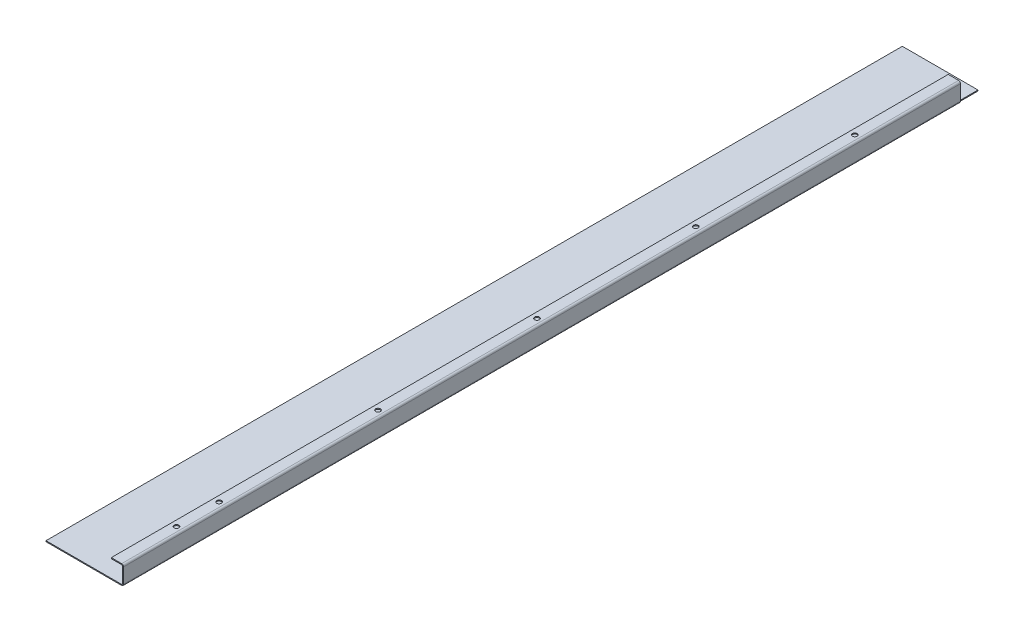
from build123d import *

# Parameters (mm, degrees)
SKETCH1_W                    = 82
SKETCH1_H                    = 905.2
BASE_FLANGE1_DEPTH           = 1
EDGE_FLANGE1_STRIP_W         = 6
EDGE_FLANGE1_STRIP_H         = 1
EDGE_FLANGE1_STRIP_CUT_DEPTH = 905.2
EDGE_FLANGE1_DEPTH           = 905.2
EDGE_FLANGE2_STRIP_W         = 6
EDGE_FLANGE2_STRIP_H         = 1
EDGE_FLANGE2_STRIP_CUT_DEPTH = 905.2
EDGE_FLANGE2_DEPTH           = 905.2
SKETCH19_R                   = 2.5
CUT_EXTRUDE2_DEPTH           = 10
CUT_EXTRUDE3_START           = -905.2
CUT_EXTRUDE3_DEPTH           = 20.5


# Read off the part's stored shape, not the designer's step: Cut-Extrude3
# Sheet-metal steps are written as plain solids
with BuildPart() as part:
    # Sketch1 → Base-Flange1 (new body)
    with BuildSketch(Plane(origin=(0, 0, 0), x_dir=(1, 0, 0), z_dir=(0, 1, 0))):
        with Locations((41, 452.6)):
            Rectangle(SKETCH1_W, SKETCH1_H)
    extrude(amount=-BASE_FLANGE1_DEPTH)

    # Edge-Flange1 strip (across the edge) → Edge-Flange1 strip cut (cut)
    with BuildSketch(Plane(origin=(82, 0, 0), x_dir=(-1, 0, 0), z_dir=(0, 0, -1))):
        with Locations((-1, -0.5)):
            Rectangle(EDGE_FLANGE1_STRIP_W, EDGE_FLANGE1_STRIP_H)
    extrude(amount=EDGE_FLANGE1_STRIP_CUT_DEPTH, mode=Mode.SUBTRACT)

    # Edge-Flange1 section (across the edge) → Edge-Flange1 (add)
    with BuildSketch(Plane(origin=(82, 0, 0), x_dir=(-1, 0, 0), z_dir=(0, 0, -1))):
        with BuildLine():
            Line((0, 1), (0, 19))
            Line((0, 19), (1, 19))
            Line((1, 19), (1, 1))
            ThreePointArc((1, 1), (1.292893219, 0.292893219), (2, 0))
            Line((2, 0), (2, -1))
            ThreePointArc((2, -1), (0.585786438, -0.414213562), (0, 1))
        make_face()
    extrude(amount=EDGE_FLANGE1_DEPTH)

    # Edge-Flange2 strip (across the edge) → Edge-Flange2 strip cut (cut)
    with BuildSketch(Plane(origin=(81, 19, 0), x_dir=(0, -1, 0), z_dir=(0, 0, -1))):
        with Locations((-1, -0.5)):
            Rectangle(EDGE_FLANGE2_STRIP_W, EDGE_FLANGE2_STRIP_H)
    extrude(amount=EDGE_FLANGE2_STRIP_CUT_DEPTH, mode=Mode.SUBTRACT)

    # Edge-Flange2 section (across the edge) → Edge-Flange2 (add)
    with BuildSketch(Plane(origin=(81, 19, 0), x_dir=(0, -1, 0), z_dir=(0, 0, -1))):
        with BuildLine():
            Line((0, 1), (0, 12))
            Line((0, 12), (1, 12))
            Line((1, 12), (1, 1))
            ThreePointArc((1, 1), (1.292893219, 0.292893219), (2, 0))
            Line((2, 0), (2, -1))
            ThreePointArc((2, -1), (0.585786438, -0.414213562), (0, 1))
        make_face()
    extrude(amount=EDGE_FLANGE2_DEPTH)

    # Sketch19 → Cut-Extrude2 (cut)
    with BuildSketch(Plane(origin=(0, 19, 0), x_dir=(1, 0, 0), z_dir=(0, 1, 0))):
        with Locations(Location((75, 63, 0), (0, 0, 180))):
            Circle(SKETCH19_R)
        with Locations(Location((75, 108, 0), (0, 0, 180))):
            Circle(SKETCH19_R)
        with Locations(Location((75, 276, 0), (0, 0, 180))):
            Circle(SKETCH19_R)
        with Locations(Location((75, 444, 0), (0, 0, 180))):
            Circle(SKETCH19_R)
        with Locations(Location((75, 612, 0), (0, 0, 180))):
            Circle(SKETCH19_R)
        with Locations(Location((75, 780, 0), (0, 0, 180))):
            Circle(SKETCH19_R)
    extrude(amount=-CUT_EXTRUDE2_DEPTH, mode=Mode.SUBTRACT)

    # Cut-Extrude3 outline → Cut-Extrude3 (cut)
    with BuildSketch(Plane.XY.offset(CUT_EXTRUDE3_START)):
        with BuildLine():
            ThreePointArc((81, 1), (80.707106781, 0.292893219), (80, 0))
            Line((80, 0), (80, -1))
            ThreePointArc((80, -1), (81.414213562, -0.414213562), (82, 1))
            Line((82, 1), (82, 17))
            ThreePointArc((82, 17), (81.414213562, 18.414213562), (80, 19))
            Line((80, 19), (69, 19))
            Line((69, 19), (69, 18))
            Line((69, 18), (80, 18))
            ThreePointArc((80, 18), (80.707106781, 17.707106781), (81, 17))
            Line((81, 17), (81, 1))
        make_face()
    extrude(amount=CUT_EXTRUDE3_DEPTH, mode=Mode.SUBTRACT)


solid = part.part
